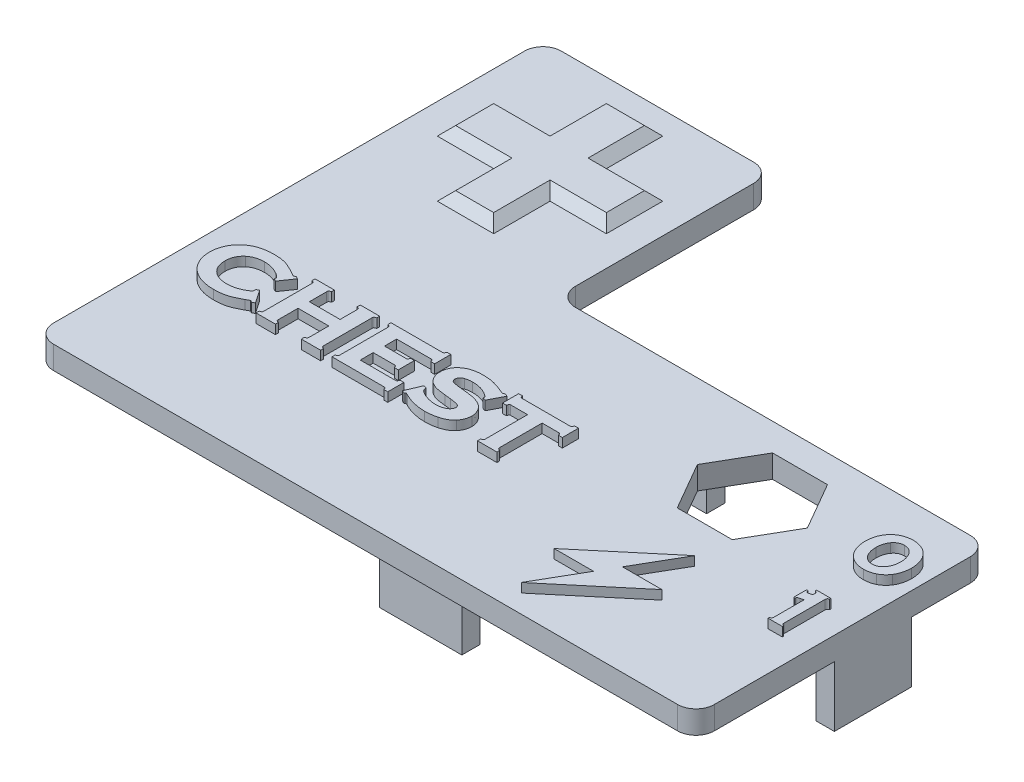
from build123d import *

# Parameters (mm, degrees)
BOSS_EXTRUDE1_DEPTH = 2.5
FILLET1_R           = 2
SKETCH2_W           = 2
SKETCH2_H           = 8.4
SKETCH2_W_2         = 9
SKETCH2_H_2         = 2
BOSS_EXTRUDE2_DEPTH = 6.6
BOSS_EXTRUDE3_DEPTH = 1
CUT_EXTRUDE1_DEPTH  = 2.5
CHAMFER1_SIZE       = 1


with BuildPart() as part:
    # Sketch1 → Boss-Extrude1 (new body)
    with BuildSketch(Plane(origin=(0, 0, 0), x_dir=(1, 0, 0), z_dir=(0, 1, 0))):
        Polygon((-36.05, 15.975), (-36.05, 39.425), (-11.05, 39.425), (-11.05, 15.975), (36.05, 15.975), (36.05, -15.975), (-36.05, -15.975), align=None)
    extrude(amount=BOSS_EXTRUDE1_DEPTH)

    # Fillet1
    fillet1_edges = [part.edges().sort_by_distance(p)[0] for p in [
        (36.05, 1.25, 15.975),
        (-36.05, 1.25, 15.975),
        (-36.05, 1.25, -39.425),
        (-11.05, 1.25, -39.425),
        (-11.05, 1.25, -15.975),
        (36.05, 1.25, -15.975),
    ]]
    fillet(fillet1_edges, radius=FILLET1_R)

    # Sketch2 → Boss-Extrude2 (add)
    with BuildSketch(Plane.XZ):
        with Locations((35.05, -3.325)):
            Rectangle(SKETCH2_W, SKETCH2_H)
        with Locations((4, -13.725)):
            Rectangle(SKETCH2_W_2, SKETCH2_H_2)
        with Locations((4, 12.975)):
            Rectangle(SKETCH2_W_2, SKETCH2_H_2)
    extrude(amount=BOSS_EXTRUDE2_DEPTH)

    # Sketch3 → Boss-Extrude3 (add)
    # profile 1 of 9: a face of its own
    with BuildSketch(Plane(origin=(0, 2.5, 0), x_dir=(1, 0, 0), z_dir=(0, 1, 0))):
        Polygon((21.914101615, -1.975), (19.027350269, -6.975), (23.328173533, -6.975), (14.985898385, -13.975), (17.872649731, -8.975), (13.571826467, -8.975), align=None)
    # profile 2 of 9: a face of its own
    with BuildSketch(Plane(origin=(0, 2.5, 0), x_dir=(1, 0, 0), z_dir=(0, 1, 0))):
        Polygon((-26.625, 36.925), (-20.475, 36.925), (-20.475, 30.775), (-14.325, 30.775), (-14.325, 24.625), (-20.475, 24.625), (-20.475, 18.475), (-26.625, 18.475), (-26.625, 24.625), (-32.775, 24.625), (-32.775, 30.775), (-26.625, 30.775), align=None)
    # profile 3 of 9: a face of its own
    with BuildSketch(Plane(origin=(0, 2.5, 0), x_dir=(1, 0, 0), z_dir=(0, 1, 0))):
        with BuildLine():
            Line((-26.894813368, -0.636469184), (-25.927430556, -2.062738715))
            Line((-25.927430556, -2.062738715), (-26.209928385, -2.217078993))
            add(Edge.make_bspline(
                [(-26.209928385, -2.217078993), (-26.236361041, -2.199689587), (-26.283095295, -2.168944249), (-26.347200787, -2.133330606), (-26.393898593, -2.108466046), (-26.421566856, -2.103251124), (-26.431792535, -2.101323785)],
                knots=[0, 0, 0, 0, 1.506381343, 2.663357431, 3.506001572, 4, 4, 4, 4], degree=3))
            add(Edge.make_bspline(
                [(-26.431792535, -2.101323785), (-26.435035074, -2.102167482), (-26.445650246, -2.104929513), (-26.465638441, -2.115542304), (-26.495961237, -2.132303643), (-26.537348116, -2.154346003), (-26.590415518, -2.181506069), (-26.65291147, -2.218056546), (-26.727248956, -2.258703637), (-26.780003792, -2.288228626), (-26.807996962, -2.303895399)],
                knots=[0, 0, 0, 0, 0.187702156, 0.614484659, 1.260601629, 2.137219343, 3.244382904, 4.606733959, 6.199439564, 8, 8, 8, 8], degree=3))
            add(Edge.make_bspline(
                [(-26.807996962, -2.303895399), (-26.87122569, -2.339102594), (-26.995129961, -2.408095311), (-27.179003486, -2.50396911), (-27.356230558, -2.591553945), (-27.527485378, -2.669878925), (-27.691605228, -2.741494197), (-27.849382389, -2.804526485), (-28.001258021, -2.855937438), (-28.196914161, -2.919009491), (-28.451683646, -2.977168748), (-28.774830314, -3.028085518), (-29.124819778, -3.058445208), (-29.366953184, -3.061573507), (-29.492415365, -3.063194444)],
                knots=[0, 0, 0, 0, 0.921054053, 1.804915809, 2.638978021, 3.436848451, 4.201446302, 4.917975105, 5.59836476, 6.24183433, 7.533677527, 8.918717815, 10.403424004, 12, 12, 12, 12], degree=3))
            add(Edge.make_bspline(
                [(-29.492415365, -3.063194444), (-29.615133451, -3.061133719), (-29.855519351, -3.057097074), (-30.207438089, -3.023871777), (-30.542298711, -2.967595861), (-30.8603479, -2.888430115), (-31.163079962, -2.790476428), (-31.448156874, -2.667282235), (-31.715978069, -2.520930779), (-31.881943534, -2.406414591), (-31.964615885, -2.34937066)],
                knots=[0, 0, 0, 0, 1.125109477, 2.20391682, 3.23774691, 4.235813866, 5.206815296, 6.152004144, 7.079458112, 8, 8, 8, 8], degree=3))
            add(Edge.make_bspline(
                [(-31.964615885, -2.34937066), (-32.057476969, -2.277589153), (-32.241429136, -2.135394349), (-32.482556536, -1.884831122), (-32.69715506, -1.613442084), (-32.81131996, -1.413445857), (-32.868608941, -1.313085937)],
                knots=[0, 0, 0, 0, 1.01448403, 2.00963125, 3.001214929, 4, 4, 4, 4], degree=3))
            add(Edge.make_bspline(
                [(-32.868608941, -1.313085937), (-32.898805478, -1.254206028), (-32.959262557, -1.136321409), (-33.035724731, -0.952288432), (-33.102709332, -0.764106586), (-33.154314765, -0.570247852), (-33.195854736, -0.372918807), (-33.226399864, -0.171006974), (-33.244766375, 0.036126499), (-33.246627979, 0.176076609), (-33.247569444, 0.246853299)],
                knots=[0, 0, 0, 0, 0.978850926, 1.959776591, 2.946525775, 3.932595758, 4.92578581, 5.929411661, 6.952845503, 8, 8, 8, 8], degree=3))
            add(Edge.make_bspline(
                [(-33.247569444, 0.246853299), (-33.245411831, 0.342030872), (-33.241147045, 0.530160944), (-33.208508022, 0.807055045), (-33.157096579, 1.075332119), (-33.080269488, 1.332476579), (-32.985256818, 1.581464209), (-32.867642042, 1.819613037), (-32.729634632, 2.04941236), (-32.621449529, 2.192197867), (-32.566818576, 2.264301215)],
                knots=[0, 0, 0, 0, 1.051920143, 2.079248334, 3.078108134, 4.067904472, 5.042050454, 6.020844056, 7.000572431, 8, 8, 8, 8], degree=3))
            add(Edge.make_bspline(
                [(-32.566818576, 2.264301215), (-32.523283593, 2.316689742), (-32.436759627, 2.420809755), (-32.297456801, 2.567911172), (-32.147445951, 2.702141162), (-31.992371448, 2.829915271), (-31.827805963, 2.945735447), (-31.654906088, 3.050704948), (-31.473596359, 3.145401826), (-31.285850321, 3.233114857), (-31.088392524, 3.306496101), (-30.884371041, 3.373958617), (-30.670871995, 3.427799372), (-30.44990146, 3.474076583), (-30.220660397, 3.507863644), (-29.98388256, 3.532495587), (-29.738831492, 3.548083786), (-29.572824216, 3.550273651), (-29.48828125, 3.551388889)],
                knots=[0, 0, 0, 0, 0.945096066, 1.878339031, 2.807896075, 3.736687935, 4.665129786, 5.597588805, 6.541329771, 7.502474639, 8.470820773, 9.462547861, 10.482887262, 11.524194462, 12.594212061, 13.69652881, 14.826905116, 16, 16, 16, 16], degree=3))
            add(Edge.make_bspline(
                [(-29.48828125, 3.551388889), (-29.363292425, 3.549107108), (-29.122114928, 3.544704199), (-28.773183497, 3.515760132), (-28.451987621, 3.46130991), (-28.19911822, 3.400725267), (-28.004813844, 3.335696444), (-27.853110278, 3.282026491), (-27.696514353, 3.213571526), (-27.530489978, 3.142517762), (-27.359965335, 3.056501073), (-27.180588871, 2.965005099), (-26.994566689, 2.862824613), (-26.86937949, 2.789628266), (-26.805240885, 2.752126736)],
                knots=[0, 0, 0, 0, 1.583391883, 3.05530107, 4.429937215, 5.707129045, 6.343800094, 7.024870534, 7.744613557, 8.507938695, 9.312046582, 10.163041542, 11.058849845, 12, 12, 12, 12], degree=3))
            add(Edge.make_bspline(
                [(-26.805240885, 2.752126736), (-26.777135195, 2.736199258), (-26.724491578, 2.706366152), (-26.652183798, 2.662475207), (-26.588497038, 2.629254216), (-26.536921736, 2.599766884), (-26.496135912, 2.575672822), (-26.464737121, 2.560520438), (-26.44529341, 2.548829556), (-26.435045732, 2.546242338), (-26.431792535, 2.545421007)],
                knots=[0, 0, 0, 0, 1.815007712, 3.399616623, 4.750773999, 5.848744586, 6.73864692, 7.408159822, 7.812116192, 8, 8, 8, 8], degree=3))
            add(Edge.make_bspline(
                [(-26.431792535, 2.545421007), (-26.42107337, 2.547256294), (-26.392633988, 2.552125558), (-26.345941342, 2.579221383), (-26.281493688, 2.616172536), (-26.234099928, 2.647507057), (-26.207172309, 2.66531033)],
                knots=[0, 0, 0, 0, 0.506273769, 1.343212145, 2.490498108, 4, 4, 4, 4], degree=3))
            Line((-26.207172309, 2.66531033), (-25.927430556, 2.504079861))
            Line((-25.927430556, 2.504079861), (-26.894813368, 1.103993056))
            Line((-26.894813368, 1.103993056), (-27.178689236, 1.233528646))
            add(Edge.make_bspline(
                [(-27.178689236, 1.233528646), (-27.175911931, 1.26795848), (-27.171397644, 1.323921428), (-27.170692376, 1.380051779), (-27.170421007, 1.401649306)],
                knots=[0, 0, 0, 0, 1.230451045, 2, 2, 2, 2], degree=3))
            add(Edge.make_bspline(
                [(-27.170421007, 1.401649306), (-27.171316158, 1.418387402), (-27.173165893, 1.452974895), (-27.194931786, 1.50301962), (-27.225446179, 1.553526706), (-27.270712144, 1.604559864), (-27.332615916, 1.659906429), (-27.416233287, 1.721160333), (-27.522243566, 1.791420225), (-27.602385498, 1.838021537), (-27.645844184, 1.863292101)],
                knots=[0, 0, 0, 0, 0.580273203, 1.199072782, 1.874962125, 2.636043996, 3.566038856, 4.767547394, 6.247133053, 8, 8, 8, 8], degree=3))
            add(Edge.make_bspline(
                [(-27.645844184, 1.863292101), (-27.711109111, 1.899463475), (-27.840561205, 1.971208903), (-28.041020986, 2.064085797), (-28.245263437, 2.140140497), (-28.45119448, 2.206395907), (-28.66087759, 2.255951479), (-28.873798779, 2.289396343), (-29.089033309, 2.313223039), (-29.233738128, 2.315515731), (-29.306380208, 2.316666667)],
                knots=[0, 0, 0, 0, 1.028142303, 2.039306239, 3.041033421, 4.030078727, 5.018921423, 6.006567867, 6.999293467, 8, 8, 8, 8], degree=3))
            add(Edge.make_bspline(
                [(-29.306380208, 2.316666667), (-29.385905192, 2.315038761), (-29.541176422, 2.311860301), (-29.768366115, 2.288229956), (-29.984203164, 2.248703574), (-30.188682329, 2.191729878), (-30.382542326, 2.120791566), (-30.564099829, 2.031608875), (-30.734616525, 1.92759366), (-30.838177751, 1.84510948), (-30.889746094, 1.804036458)],
                knots=[0, 0, 0, 0, 1.122809716, 2.192267609, 3.221470532, 4.217602693, 5.186305145, 6.131997782, 7.069827752, 8, 8, 8, 8], degree=3))
            add(Edge.make_bspline(
                [(-30.889746094, 1.804036458), (-30.944258928, 1.755664238), (-31.052194066, 1.659887485), (-31.191202935, 1.495833836), (-31.310017959, 1.319693308), (-31.404961245, 1.129348929), (-31.479968909, 0.926536972), (-31.533508847, 0.710777157), (-31.565597749, 0.481623582), (-31.569747825, 0.324587891), (-31.571875, 0.244097222)],
                knots=[0, 0, 0, 0, 0.991916837, 1.963990341, 2.920404688, 3.880416128, 4.854642933, 5.861005588, 6.903630834, 8, 8, 8, 8], degree=3))
            add(Edge.make_bspline(
                [(-31.571875, 0.244097222), (-31.569743111, 0.163608295), (-31.565583838, 0.006576002), (-31.533560568, -0.22260182), (-31.479680222, -0.438693381), (-31.405303919, -0.642203146), (-31.309966248, -0.83284883), (-31.191262366, -1.009073472), (-31.051799803, -1.173109701), (-30.94420348, -1.269707402), (-30.889746094, -1.31859809)],
                knots=[0, 0, 0, 0, 1.094980273, 2.136284708, 3.141372491, 4.120229904, 5.07902519, 6.03422794, 7.00507001, 8, 8, 8, 8], degree=3))
            add(Edge.make_bspline(
                [(-30.889746094, -1.31859809), (-30.83823079, -1.359748954), (-30.734964003, -1.442239344), (-30.564048106, -1.544883236), (-30.382546995, -1.632015097), (-30.189752114, -1.703923292), (-29.985550298, -1.760423855), (-29.769306286, -1.800176346), (-29.541625082, -1.823588692), (-29.385902382, -1.826821394), (-29.306380208, -1.828472222)],
                knots=[0, 0, 0, 0, 0.930852733, 1.865973124, 2.809526276, 3.772855155, 4.769716054, 5.799671909, 6.876368871, 8, 8, 8, 8], degree=3))
            add(Edge.make_bspline(
                [(-29.306380208, -1.828472222), (-29.233753815, -1.827151687), (-29.088668334, -1.824513658), (-28.87279357, -1.80311089), (-28.659447384, -1.769213438), (-28.450323453, -1.718862092), (-28.243630831, -1.656596479), (-28.039691038, -1.5813472), (-27.839545103, -1.489781113), (-27.709783751, -1.419913158), (-27.644466146, -1.384743924)],
                knots=[0, 0, 0, 0, 1.001816356, 2.001324861, 2.990066645, 3.980006005, 4.966409349, 5.967022273, 6.97666575, 8, 8, 8, 8], degree=3))
            add(Edge.make_bspline(
                [(-27.644466146, -1.384743924), (-27.601023221, -1.359918619), (-27.520957927, -1.314165591), (-27.414906015, -1.245324487), (-27.3314701, -1.185321704), (-27.26891952, -1.131495266), (-27.224212527, -1.080408787), (-27.193517506, -1.030629671), (-27.173321859, -0.980641329), (-27.171378139, -0.946703212), (-27.170421007, -0.929991319)],
                knots=[0, 0, 0, 0, 1.757425455, 3.238934429, 4.439578554, 5.365580981, 6.132204324, 6.813014849, 7.415501801, 8, 8, 8, 8], degree=3))
            add(Edge.make_bspline(
                [(-27.170421007, -0.929991319), (-27.17068799, -0.909311841), (-27.171377153, -0.855932009), (-27.175911504, -0.802730191), (-27.178689236, -0.770138889)],
                knots=[0, 0, 0, 0, 0.774804922, 2, 2, 2, 2], degree=3))
            Line((-27.178689236, -0.770138889), (-26.894813368, -0.636469184))
        make_face()
    # profile 4 of 9: a face of its own
    with BuildSketch(Plane(origin=(0, 2.5, 0), x_dir=(1, 0, 0), z_dir=(0, 1, 0))):
        with BuildLine():
            Line((-19.753819444, -0.240972222), (-23.105208333, -0.240972222))
            Line((-23.105208333, -0.240972222), (-23.105208333, -2.383821615))
            add(Edge.make_bspline(
                [(-23.105208333, -2.383821615), (-23.104699813, -2.404062044), (-23.103771671, -2.441004541), (-23.096863022, -2.491370285), (-23.08705265, -2.531950328), (-23.069274696, -2.565289708), (-23.036066596, -2.591094351), (-22.987569905, -2.614286603), (-22.920184581, -2.63858303), (-22.869172598, -2.654599914), (-22.840625, -2.663563368)],
                knots=[0, 0, 0, 0, 1.112689861, 2.030863194, 2.79083513, 3.401849183, 4.06495506, 5.059212787, 6.354261028, 8, 8, 8, 8], degree=3))
            Line((-22.840625, -2.663563368), (-22.840625, -2.975))
            Line((-22.840625, -2.975), (-24.957291667, -2.975))
            Line((-24.957291667, -2.975), (-24.957291667, -2.645648872))
            add(Edge.make_bspline(
                [(-24.957291667, -2.645648872), (-24.929235748, -2.636151769), (-24.878729532, -2.619055102), (-24.811750054, -2.594288211), (-24.763940792, -2.568428587), (-24.720966902, -2.534493362), (-24.696227789, -2.468688109), (-24.693987836, -2.41467495), (-24.692708333, -2.383821615)],
                knots=[0, 0, 0, 0, 1.287370472, 2.317522002, 3.094744379, 3.646673391, 4.655735433, 6, 6, 6, 6], degree=3))
            Line((-24.692708333, -2.383821615), (-24.692708333, 2.872016059))
            add(Edge.make_bspline(
                [(-24.692708333, 2.872016059), (-24.693871972, 2.90291911), (-24.695893403, 2.956602786), (-24.721358131, 3.02155467), (-24.763923688, 3.055250295), (-24.811757099, 3.081102433), (-24.878726996, 3.105872295), (-24.929234842, 3.122968456), (-24.957291667, 3.132465278)],
                knots=[0, 0, 0, 0, 1.348336138, 2.342281394, 2.895882114, 3.675458579, 4.708730281, 6, 6, 6, 6], degree=3))
            Line((-24.957291667, 3.132465278), (-24.957291667, 3.463194444))
            Line((-24.957291667, 3.463194444), (-22.840625, 3.463194444))
            Line((-22.840625, 3.463194444), (-22.840625, 3.149001736))
            add(Edge.make_bspline(
                [(-22.840625, 3.149001736), (-22.869715234, 3.140736863), (-22.921468391, 3.12603319), (-22.988507273, 3.100588695), (-23.037628163, 3.079363184), (-23.070389512, 3.053980126), (-23.086780103, 3.021221078), (-23.097163429, 2.98196032), (-23.103627931, 2.932384698), (-23.104652701, 2.895920899), (-23.105208333, 2.876150174)],
                knots=[0, 0, 0, 0, 1.678835892, 2.986743234, 3.979464292, 4.649154438, 5.231503203, 5.974457713, 6.90174799, 8, 8, 8, 8], degree=3))
            Line((-23.105208333, 2.876150174), (-23.105208333, 0.99375))
            Line((-23.105208333, 0.99375), (-19.753819444, 0.99375))
            Line((-19.753819444, 0.99375), (-19.753819444, 2.876150174))
            add(Edge.make_bspline(
                [(-19.753819444, 2.876150174), (-19.754774347, 2.906725209), (-19.756469194, 2.960992525), (-19.784941489, 3.024988409), (-19.827691495, 3.059427337), (-19.875101744, 3.085011392), (-19.940852101, 3.108918029), (-19.990740087, 3.123179378), (-20.018402778, 3.13108724)],
                knots=[0, 0, 0, 0, 1.339108124, 2.3767692, 2.934819577, 3.720662016, 4.736116083, 6, 6, 6, 6], degree=3))
            Line((-20.018402778, 3.13108724), (-20.018402778, 3.463194444))
            Line((-20.018402778, 3.463194444), (-17.901736111, 3.463194444))
            Line((-17.901736111, 3.463194444), (-17.901736111, 3.151757813))
            add(Edge.make_bspline(
                [(-17.901736111, 3.151757813), (-17.930756349, 3.142373337), (-17.982743019, 3.125562048), (-18.050885467, 3.099834777), (-18.099818842, 3.076489432), (-18.132921051, 3.051272443), (-18.149192131, 3.018441172), (-18.160019487, 2.979312497), (-18.164212942, 2.929039758), (-18.165573084, 2.892220265), (-18.166319444, 2.872016059)],
                knots=[0, 0, 0, 0, 1.677063113, 3.004280154, 3.998210204, 4.661097541, 5.237530725, 5.972938197, 6.887676847, 8, 8, 8, 8], degree=3))
            Line((-18.166319444, 2.872016059), (-18.166319444, -2.383821615))
            add(Edge.make_bspline(
                [(-18.166319444, -2.383821615), (-18.165605272, -2.404487304), (-18.164316812, -2.441770881), (-18.15981505, -2.492921509), (-18.149384436, -2.532520488), (-18.133272035, -2.565849021), (-18.099476921, -2.589006053), (-18.052193072, -2.613649766), (-17.983620937, -2.638792842), (-17.931188556, -2.655536255), (-17.901736111, -2.664941406)],
                knots=[0, 0, 0, 0, 1.132588045, 2.043335292, 2.79974177, 3.373659724, 4.017655279, 4.984956659, 6.306382474, 8, 8, 8, 8], degree=3))
            Line((-17.901736111, -2.664941406), (-17.901736111, -2.975))
            Line((-17.901736111, -2.975), (-20.018402778, -2.975))
            Line((-20.018402778, -2.975), (-20.018402778, -2.644270833))
            add(Edge.make_bspline(
                [(-20.018402778, -2.644270833), (-19.990652242, -2.636054777), (-19.940548721, -2.62122071), (-19.875966499, -2.594668492), (-19.826802485, -2.571594882), (-19.785260489, -2.534759181), (-19.756381284, -2.470161631), (-19.754742046, -2.414915461), (-19.753819444, -2.383821615)],
                knots=[0, 0, 0, 0, 1.258257265, 2.271780215, 3.040906906, 3.607086496, 4.653211897, 6, 6, 6, 6], degree=3))
            Line((-19.753819444, -2.383821615), (-19.753819444, -0.240972222))
        make_face()
    # profile 5 of 9: a face of its own
    with BuildSketch(Plane(origin=(0, 2.5, 0), x_dir=(1, 0, 0), z_dir=(0, 1, 0))):
        with BuildLine():
            Line((-14.814930556, -0.329166667), (-14.814930556, -1.740277778))
            Line((-14.814930556, -1.740277778), (-10.997764757, -1.740277778))
            add(Edge.make_bspline(
                [(-10.997764757, -1.740277778), (-10.96681399, -1.739196439), (-10.912435727, -1.737296604), (-10.847344175, -1.710572029), (-10.813073957, -1.667750897), (-10.787572958, -1.619542044), (-10.760706746, -1.553870821), (-10.744714098, -1.50339503), (-10.7359375, -1.475694444)],
                knots=[0, 0, 0, 0, 1.34636125, 2.365459444, 2.918249314, 3.696683944, 4.73596426, 6, 6, 6, 6], degree=3))
            Line((-10.7359375, -1.475694444), (-10.317013889, -1.475694444))
            Line((-10.317013889, -1.475694444), (-10.317013889, -3.239583333))
            Line((-10.317013889, -3.239583333), (-10.7359375, -3.239583333))
            add(Edge.make_bspline(
                [(-10.7359375, -3.239583333), (-10.745417741, -3.211528728), (-10.762347615, -3.161428635), (-10.787206374, -3.094617869), (-10.814588681, -3.047847345), (-10.848355915, -3.005029981), (-10.911432841, -2.978204932), (-10.964041962, -2.976153677), (-10.993630642, -2.975)],
                knots=[0, 0, 0, 0, 1.304247938, 2.329134225, 3.126603422, 3.68576824, 4.698418437, 6, 6, 6, 6], degree=3))
            Line((-10.993630642, -2.975), (-16.667013889, -2.975))
            Line((-16.667013889, -2.975), (-16.667013889, -2.645648872))
            add(Edge.make_bspline(
                [(-16.667013889, -2.645648872), (-16.638958843, -2.636151539), (-16.588454199, -2.619054457), (-16.521465486, -2.594290002), (-16.473679502, -2.568424236), (-16.430297605, -2.534244531), (-16.405801517, -2.466247275), (-16.403664548, -2.41050045), (-16.402430556, -2.378309462)],
                knots=[0, 0, 0, 0, 1.270903566, 2.287878308, 3.055159144, 3.600028367, 4.614137041, 6, 6, 6, 6], degree=3))
            Line((-16.402430556, -2.378309462), (-16.402430556, 2.866503906))
            add(Edge.make_bspline(
                [(-16.402430556, 2.866503906), (-16.403546203, 2.898744591), (-16.405463775, 2.954159803), (-16.430686729, 3.021309284), (-16.473663711, 3.055245134), (-16.52147199, 3.081104559), (-16.588451858, 3.105871529), (-16.638958007, 3.122968183), (-16.667013889, 3.132465278)],
                knots=[0, 0, 0, 0, 1.390022291, 2.38916702, 2.935671537, 3.705255179, 4.725282125, 6, 6, 6, 6], degree=3))
            Line((-16.667013889, 3.132465278), (-16.667013889, 3.463194444))
            Line((-16.667013889, 3.463194444), (-11.083203125, 3.463194444))
            add(Edge.make_bspline(
                [(-11.083203125, 3.463194444), (-11.053150653, 3.46428904), (-11.000072459, 3.466222296), (-10.936541645, 3.49321999), (-10.902802892, 3.53604972), (-10.875057591, 3.583131768), (-10.851140482, 3.650308925), (-10.83373638, 3.700229281), (-10.824131944, 3.727777778)],
                knots=[0, 0, 0, 0, 1.317339458, 2.326663858, 2.883992238, 3.678842347, 4.719071565, 6, 6, 6, 6], degree=3))
            Line((-10.824131944, 3.727777778), (-10.405208333, 3.727777778))
            Line((-10.405208333, 3.727777778), (-10.405208333, 1.963888889))
            Line((-10.405208333, 1.963888889), (-10.824131944, 1.963888889))
            add(Edge.make_bspline(
                [(-10.824131944, 1.963888889), (-10.832807687, 1.99164166), (-10.848490131, 2.041808123), (-10.876233321, 2.106542284), (-10.901022192, 2.155193321), (-10.937673782, 2.197088972), (-11.001980788, 2.225704461), (-11.056725918, 2.227479622), (-11.08733724, 2.228472222)],
                knots=[0, 0, 0, 0, 1.263696698, 2.284283375, 3.062509213, 3.628357544, 4.673870881, 6, 6, 6, 6], degree=3))
            Line((-11.08733724, 2.228472222), (-14.814930556, 2.228472222))
            Line((-14.814930556, 2.228472222), (-14.814930556, 0.905555556))
            Line((-14.814930556, 0.905555556), (-12.494314236, 0.905555556))
            add(Edge.make_bspline(
                [(-12.494314236, 0.905555556), (-12.463401105, 0.906713921), (-12.409699916, 0.908726192), (-12.344839217, 0.934238618), (-12.310679077, 0.977014664), (-12.286041557, 1.025458111), (-12.259780326, 1.091604251), (-12.244038704, 1.141987303), (-12.235243056, 1.170138889)],
                knots=[0, 0, 0, 0, 1.350007337, 2.345184541, 2.899471423, 3.697568048, 4.713513627, 6, 6, 6, 6], degree=3))
            Line((-12.235243056, 1.170138889), (-11.816319444, 1.170138889))
            Line((-11.816319444, 1.170138889), (-11.816319444, -0.59375))
            Line((-11.816319444, -0.59375), (-12.235243056, -0.59375))
            add(Edge.make_bspline(
                [(-12.235243056, -0.59375), (-12.244812139, -0.566642156), (-12.262127324, -0.517590719), (-12.286491853, -0.451549956), (-12.31386803, -0.404719593), (-12.347894063, -0.361965651), (-12.41079639, -0.333328245), (-12.464181571, -0.330668136), (-12.494314236, -0.329166667)],
                knots=[0, 0, 0, 0, 1.26750182, 2.293534889, 3.091896403, 3.651686891, 4.674521096, 6, 6, 6, 6], degree=3))
            Line((-12.494314236, -0.329166667), (-14.814930556, -0.329166667))
        make_face()
    # profile 6 of 9: a face of its own
    with BuildSketch(Plane(origin=(0, 2.5, 0), x_dir=(1, 0, 0), z_dir=(0, 1, 0))):
        with BuildLine():
            Line((-3.396506076, 2.847211372), (-4.220572917, 1.270735677))
            Line((-4.220572917, 1.270735677), (-4.532009549, 1.382356771))
            add(Edge.make_bspline(
                [(-4.532009549, 1.382356771), (-4.531071564, 1.408998199), (-4.52963228, 1.449877955), (-4.52832927, 1.490762258), (-4.527875434, 1.50500217)],
                knots=[0, 0, 0, 0, 1.303404452, 2, 2, 2, 2], degree=3))
            add(Edge.make_bspline(
                [(-4.527875434, 1.50500217), (-4.531125911, 1.524381846), (-4.538585205, 1.568854918), (-4.588418516, 1.631134968), (-4.660714707, 1.698118882), (-4.721478584, 1.740511258), (-4.755251736, 1.764073351)],
                knots=[0, 0, 0, 0, 0.655057032, 1.503244898, 2.612279321, 4, 4, 4, 4], degree=3))
            add(Edge.make_bspline(
                [(-4.755251736, 1.764073351), (-4.822044163, 1.808460817), (-4.955105924, 1.896888124), (-5.167567756, 2.007837062), (-5.387171536, 2.103368779), (-5.615472255, 2.182513179), (-5.852915023, 2.243048336), (-6.099039197, 2.285042717), (-6.353153785, 2.312478648), (-6.525499095, 2.315258023), (-6.612847222, 2.316666667)],
                knots=[0, 0, 0, 0, 0.976967083, 1.946282931, 2.916762424, 3.894194695, 4.888260298, 5.899910281, 6.935631579, 8, 8, 8, 8], degree=3))
            add(Edge.make_bspline(
                [(-6.612847222, 2.316666667), (-6.682281156, 2.315566917), (-6.817844475, 2.313419758), (-7.015820734, 2.290151054), (-7.204201107, 2.25570167), (-7.324179757, 2.219894889), (-7.383170573, 2.202289497)],
                knots=[0, 0, 0, 0, 1.065149838, 2.079606309, 3.055785418, 4, 4, 4, 4], degree=3))
            add(Edge.make_bspline(
                [(-7.383170573, 2.202289497), (-7.413827826, 2.190178609), (-7.475142331, 2.165956834), (-7.561357261, 2.115894538), (-7.639578869, 2.053081321), (-7.71152947, 1.982030389), (-7.772379165, 1.902149433), (-7.815740223, 1.813192561), (-7.843482144, 1.717962957), (-7.846190433, 1.651727297), (-7.847569444, 1.618001302)],
                knots=[0, 0, 0, 0, 0.993652996, 1.987305992, 2.99382794, 4.013056368, 5.033132543, 6.006275506, 6.984831695, 8, 8, 8, 8], degree=3))
            add(Edge.make_bspline(
                [(-7.847569444, 1.618001302), (-7.846946797, 1.593588457), (-7.845749055, 1.546627243), (-7.831826301, 1.47949037), (-7.808147375, 1.41955602), (-7.776141457, 1.366310383), (-7.734906495, 1.319308723), (-7.683960058, 1.279653977), (-7.623332768, 1.247889009), (-7.579526063, 1.232081687), (-7.556803385, 1.223882378)],
                knots=[0, 0, 0, 0, 1.102963316, 2.12169029, 3.082404965, 4.00530384, 4.918090382, 5.894847784, 6.908050859, 8, 8, 8, 8], degree=3))
            add(Edge.make_bspline(
                [(-7.556803385, 1.223882378), (-7.536181892, 1.218172449), (-7.490634464, 1.205560724), (-7.414639955, 1.189599656), (-7.324600578, 1.172953382), (-7.220679208, 1.156942698), (-7.102215609, 1.139945001), (-6.969727656, 1.124464011), (-6.822979939, 1.105336417), (-6.720369536, 1.095413397), (-6.666590712, 1.090212674)],
                knots=[0, 0, 0, 0, 0.569784533, 1.25850343, 2.067174491, 3.00850413, 4.058735915, 5.254514493, 6.561071985, 8, 8, 8, 8], degree=3))
            Line((-6.666590712, 1.090212674), (-5.962413194, 1.017176649))
            add(Edge.make_bspline(
                [(-5.962413194, 1.017176649), (-5.856181715, 1.004735653), (-5.653781292, 0.981032106), (-5.367106588, 0.933571788), (-5.111268955, 0.88297866), (-4.884936201, 0.821623451), (-4.681878996, 0.752060344), (-4.496842804, 0.6732499), (-4.325767179, 0.586592094), (-4.222678428, 0.516649739), (-4.17234158, 0.48249783)],
                knots=[0, 0, 0, 0, 1.359231557, 2.589713005, 3.6923467, 4.672414876, 5.567883986, 6.418052333, 7.227556273, 8, 8, 8, 8], degree=3))
            add(Edge.make_bspline(
                [(-4.17234158, 0.48249783), (-4.11372012, 0.437035481), (-3.998564968, 0.347729899), (-3.848468993, 0.191433762), (-3.722633089, 0.020835959), (-3.619107869, -0.161703039), (-3.537918877, -0.352770735), (-3.479985069, -0.549265712), (-3.44371651, -0.74996084), (-3.439812767, -0.885282954), (-3.437847222, -0.953417969)],
                knots=[0, 0, 0, 0, 1.062112761, 2.086399006, 3.093661336, 4.093127116, 5.087223183, 6.062081265, 7.024253179, 8, 8, 8, 8], degree=3))
            add(Edge.make_bspline(
                [(-3.437847222, -0.953417969), (-3.439032518, -1.008160881), (-3.441392998, -1.11717971), (-3.464659542, -1.278506544), (-3.50004607, -1.436924761), (-3.551858034, -1.591566624), (-3.616479991, -1.743382956), (-3.695823682, -1.891791846), (-3.789553809, -2.037269966), (-3.862395816, -2.129016611), (-3.899490017, -2.175737847)],
                knots=[0, 0, 0, 0, 0.984507936, 1.960617353, 2.927124942, 3.902113762, 4.890880584, 5.892997435, 6.927026006, 8, 8, 8, 8], degree=3))
            add(Edge.make_bspline(
                [(-3.899490017, -2.175737847), (-3.933030113, -2.214759917), (-4.001404015, -2.29430922), (-4.123857762, -2.399322334), (-4.258267314, -2.500788125), (-4.410245913, -2.592262154), (-4.575512746, -2.680245442), (-4.758529332, -2.757134696), (-4.955509994, -2.831721474), (-5.094381735, -2.871717765), (-5.165907118, -2.892317708)],
                knots=[0, 0, 0, 0, 0.834835566, 1.701872463, 2.613833744, 3.568666275, 4.580119083, 5.653131184, 6.791253792, 8, 8, 8, 8], degree=3))
            add(Edge.make_bspline(
                [(-5.165907118, -2.892317708), (-5.268460318, -2.91868686), (-5.477037057, -2.972317481), (-5.802029873, -3.024573512), (-6.141355552, -3.056822681), (-6.3725335, -3.061045203), (-6.490201823, -3.063194444)],
                knots=[0, 0, 0, 0, 0.948384972, 1.928862733, 2.945802358, 4, 4, 4, 4], degree=3))
            add(Edge.make_bspline(
                [(-6.490201823, -3.063194444), (-6.594073086, -3.061238036), (-6.801256402, -3.057335751), (-7.111462154, -3.028897179), (-7.420299387, -2.982297726), (-7.727927407, -2.915498841), (-8.034936419, -2.831363228), (-8.340534073, -2.728065519), (-8.644850754, -2.60498281), (-8.843893246, -2.510248042), (-8.944487847, -2.462369792)],
                knots=[0, 0, 0, 0, 0.977743129, 1.950222396, 2.929942918, 3.916330384, 4.911888304, 5.925169257, 6.951395912, 8, 8, 8, 8], degree=3))
            add(Edge.make_bspline(
                [(-8.944487847, -2.462369792), (-8.979313752, -2.446069282), (-9.040045766, -2.417643237), (-9.118767305, -2.383867118), (-9.170860179, -2.360468486), (-9.198442536, -2.354221768), (-9.207693142, -2.352126736)],
                knots=[0, 0, 0, 0, 1.613868705, 2.814384752, 3.602366811, 4, 4, 4, 4], degree=3))
            add(Edge.make_bspline(
                [(-9.207693142, -2.352126736), (-9.207071646, -2.354015237), (-9.203130554, -2.365990771), (-9.243448107, -2.38098481), (-9.282575503, -2.412506079), (-9.324582948, -2.436837304), (-9.349631076, -2.451345486)],
                knots=[0, 0, 0, 0, 0.128302542, 0.813604024, 2.100021208, 4, 4, 4, 4], degree=3))
            Line((-9.349631076, -2.451345486), (-9.611458333, -2.336968316))
            Line((-9.611458333, -2.336968316), (-8.907280816, -0.67781033))
            Line((-8.907280816, -0.67781033), (-8.566905382, -0.803211806))
            add(Edge.make_bspline(
                [(-8.566905382, -0.803211806), (-8.566905382, -0.821585648), (-8.566905382, -0.85052445), (-8.566905382, -0.879463252), (-8.566905382, -0.890028212)],
                knots=[0, 0, 0, 0, 1.26984127, 2, 2, 2, 2], degree=3))
            add(Edge.make_bspline(
                [(-8.566905382, -0.890028212), (-8.565491784, -0.92101203), (-8.562761806, -0.980848792), (-8.536570225, -1.065710803), (-8.495391203, -1.142420922), (-8.455008555, -1.183482961), (-8.434613715, -1.20422092)],
                knots=[0, 0, 0, 0, 1.056364862, 2.040079546, 3.010162421, 4, 4, 4, 4], degree=3))
            add(Edge.make_bspline(
                [(-8.434613715, -1.20422092), (-8.381467135, -1.248395321), (-8.270081622, -1.340976786), (-8.071958823, -1.457040905), (-7.842582928, -1.562099096), (-7.587161126, -1.654927472), (-7.318266331, -1.729791929), (-7.049738262, -1.787358328), (-6.786917009, -1.821703097), (-6.613859823, -1.826241296), (-6.528786892, -1.828472222)],
                knots=[0, 0, 0, 0, 0.811166888, 1.700057442, 2.688020544, 3.774312476, 4.890449695, 5.966279675, 7.000246384, 8, 8, 8, 8], degree=3))
            add(Edge.make_bspline(
                [(-6.528786892, -1.828472222), (-6.438125066, -1.82636084), (-6.262876153, -1.822279546), (-6.011011301, -1.783403444), (-5.777896419, -1.726337654), (-5.636892159, -1.662479461), (-5.568294271, -1.63141276)],
                knots=[0, 0, 0, 0, 1.09938514, 2.125106669, 3.087873494, 4, 4, 4, 4], degree=3))
            add(Edge.make_bspline(
                [(-5.568294271, -1.63141276), (-5.534790461, -1.613292279), (-5.469416095, -1.57793466), (-5.379859877, -1.513495114), (-5.300994711, -1.440865937), (-5.23496187, -1.359141572), (-5.181707591, -1.273472194), (-5.141918791, -1.186215136), (-5.119053808, -1.097424705), (-5.115372219, -1.038057786), (-5.113541667, -1.008539497)],
                knots=[0, 0, 0, 0, 1.127511017, 2.200057805, 3.259226553, 4.294254806, 5.302547675, 6.240723916, 7.125256589, 8, 8, 8, 8], degree=3))
            add(Edge.make_bspline(
                [(-5.113541667, -1.008539497), (-5.11633523, -0.968832587), (-5.121748434, -0.891890852), (-5.176168109, -0.786969664), (-5.262474176, -0.700550044), (-5.338051964, -0.66497705), (-5.378125, -0.646115451)],
                knots=[0, 0, 0, 0, 0.989643958, 1.917674357, 2.89590429, 4, 4, 4, 4], degree=3))
            add(Edge.make_bspline(
                [(-5.378125, -0.646115451), (-5.398254181, -0.638528699), (-5.442597691, -0.62181549), (-5.51715867, -0.60010506), (-5.605680884, -0.580050299), (-5.70812065, -0.559223294), (-5.824902926, -0.539011798), (-5.955718879, -0.517985245), (-6.100579072, -0.499249689), (-6.201723208, -0.487098313), (-6.254557292, -0.480750868)],
                knots=[0, 0, 0, 0, 0.577433191, 1.27205443, 2.082779499, 3.014009565, 4.078543733, 5.264728481, 6.571191888, 8, 8, 8, 8], degree=3))
            Line((-6.254557292, -0.480750868), (-6.924283854, -0.407714844))
            add(Edge.make_bspline(
                [(-6.924283854, -0.407714844), (-6.979438476, -0.40202317), (-7.085716196, -0.391055855), (-7.238448062, -0.370744901), (-7.379186857, -0.353704117), (-7.507157169, -0.3349167), (-7.622837707, -0.319860836), (-7.725374205, -0.30063308), (-7.815698568, -0.285130712), (-7.968863282, -0.252250524), (-8.191066767, -0.184186468), (-8.375538468, -0.094293608), (-8.470442708, -0.048046875)],
                knots=[0, 0, 0, 0, 1.040628763, 2.005192832, 2.891695548, 3.701287162, 4.432842532, 5.080600743, 5.658946044, 6.152708285, 8.020702925, 10, 10, 10, 10], degree=3))
            add(Edge.make_bspline(
                [(-8.470442708, -0.048046875), (-8.538035321, -0.009736726), (-8.672705947, 0.066591906), (-8.849291515, 0.21918362), (-9.007326639, 0.39471757), (-9.089007294, 0.530577662), (-9.130523003, 0.599631076)],
                knots=[0, 0, 0, 0, 0.991843038, 1.976134926, 2.971332993, 4, 4, 4, 4], degree=3))
            add(Edge.make_bspline(
                [(-9.130523003, 0.599631076), (-9.16422127, 0.665854384), (-9.232041585, 0.799133806), (-9.298060793, 1.017041763), (-9.339246881, 1.248024992), (-9.344289671, 1.406975333), (-9.346875, 1.488465712)],
                knots=[0, 0, 0, 0, 0.962940006, 1.93798971, 2.942852229, 4, 4, 4, 4], degree=3))
            add(Edge.make_bspline(
                [(-9.346875, 1.488465712), (-9.345435647, 1.555616403), (-9.342604615, 1.687693648), (-9.315870901, 1.881159025), (-9.271795126, 2.065288368), (-9.210574467, 2.240125013), (-9.133564798, 2.407212363), (-9.036193094, 2.563991122), (-8.922932157, 2.712991808), (-8.835665552, 2.803041676), (-8.791525608, 2.84858941)],
                knots=[0, 0, 0, 0, 1.065965528, 2.096624593, 3.094544275, 4.068143509, 5.034170249, 6.010062491, 6.993478318, 8, 8, 8, 8], degree=3))
            add(Edge.make_bspline(
                [(-8.791525608, 2.84858941), (-8.729614987, 2.905572524), (-8.604701926, 3.020543673), (-8.387548359, 3.160632312), (-8.151951259, 3.28361875), (-7.893322799, 3.382284207), (-7.612793969, 3.457342981), (-7.310989902, 3.512305717), (-6.987036722, 3.545467514), (-6.763592605, 3.54937783), (-6.648676215, 3.551388889)],
                knots=[0, 0, 0, 0, 0.871812825, 1.759000444, 2.671569174, 3.626832589, 4.624865648, 5.681466624, 6.80758783, 8, 8, 8, 8], degree=3))
            add(Edge.make_bspline(
                [(-6.648676215, 3.551388889), (-6.546200895, 3.549719723), (-6.344653986, 3.546436832), (-6.047795039, 3.522967694), (-5.762140616, 3.482846251), (-5.480258673, 3.426790799), (-5.190550713, 3.347754653), (-4.878460325, 3.248568413), (-4.539543499, 3.121751915), (-4.30573484, 3.0256605), (-4.183365885, 2.975368924)],
                knots=[0, 0, 0, 0, 0.96390803, 1.895799719, 2.798959555, 3.676015856, 4.597298917, 5.622179955, 6.755515068, 8, 8, 8, 8], degree=3))
            add(Edge.make_bspline(
                [(-4.183365885, 2.975368924), (-4.147136974, 2.96095311), (-4.084825053, 2.936158629), (-4.004954486, 2.906630382), (-3.955784245, 2.885414809), (-3.931218087, 2.879262182), (-3.924294705, 2.877528212)],
                knots=[0, 0, 0, 0, 1.688451775, 2.904052912, 3.69113363, 4, 4, 4, 4], degree=3))
            add(Edge.make_bspline(
                [(-3.924294705, 2.877528212), (-3.911313084, 2.879360506), (-3.880275867, 2.883741261), (-3.8288052, 2.905666831), (-3.7645496, 2.9382686), (-3.719156434, 2.967527046), (-3.694162326, 2.983637153)],
                knots=[0, 0, 0, 0, 0.613533705, 1.466872198, 2.605224696, 4, 4, 4, 4], degree=3))
            Line((-3.694162326, 2.983637153), (-3.396506076, 2.847211372))
        make_face()
    # profile 7 of 9: a face of its own
    with BuildSketch(Plane(origin=(0, 2.5, 0), x_dir=(1, 0, 0), z_dir=(0, 1, 0))):
        with BuildLine():
            Line((1.060069444, 2.228472222), (1.060069444, -2.3796875))
            add(Edge.make_bspline(
                [(1.060069444, -2.3796875), (1.060826238, -2.400806929), (1.062211071, -2.439452674), (1.066297355, -2.492040136), (1.077012132, -2.53252013), (1.093114816, -2.565849116), (1.126912858, -2.589006012), (1.17419543, -2.613649784), (1.242768097, -2.638792835), (1.295200385, -2.655536253), (1.324652778, -2.664941406)],
                knots=[0, 0, 0, 0, 1.146938464, 2.098744851, 2.848115152, 3.416694457, 4.054699493, 5.013002928, 6.322136693, 8, 8, 8, 8], degree=3))
            Line((1.324652778, -2.664941406), (1.324652778, -2.975))
            Line((1.324652778, -2.975), (-0.792013889, -2.975))
            Line((-0.792013889, -2.975), (-0.792013889, -2.645648872))
            add(Edge.make_bspline(
                [(-0.792013889, -2.645648872), (-0.763958833, -2.636151535), (-0.713454171, -2.619054447), (-0.646465564, -2.594290031), (-0.598679313, -2.568424167), (-0.555298265, -2.534244771), (-0.530958788, -2.46669776), (-0.528717175, -2.41141701), (-0.527430556, -2.3796875)],
                knots=[0, 0, 0, 0, 1.275068922, 2.295376775, 3.065172355, 3.611827374, 4.629259765, 6, 6, 6, 6], degree=3))
            Line((-0.527430556, -2.3796875), (-0.527430556, 2.228472222))
            Line((-0.527430556, 2.228472222), (-2.398806424, 2.228472222))
            add(Edge.make_bspline(
                [(-2.398806424, 2.228472222), (-2.415813174, 2.227721216), (-2.44651406, 2.226365487), (-2.48658391, 2.210679278), (-2.508287726, 2.174573654), (-2.529060744, 2.126556576), (-2.555136288, 2.053460337), (-2.573131921, 1.99655772), (-2.583463542, 1.963888889)],
                knots=[0, 0, 0, 0, 0.870643512, 1.571701028, 2.05851096, 2.958822901, 4.254004665, 6, 6, 6, 6], degree=3))
            Line((-2.583463542, 1.963888889), (-2.996875, 1.963888889))
            Line((-2.996875, 1.963888889), (-2.996875, 3.727777778))
            Line((-2.996875, 3.727777778), (-2.587597656, 3.727777778))
            add(Edge.make_bspline(
                [(-2.587597656, 3.727777778), (-2.576143444, 3.695651091), (-2.556103843, 3.639444172), (-2.52971702, 3.566091176), (-2.506220253, 3.518669558), (-2.48606916, 3.481412246), (-2.447476558, 3.465583169), (-2.418572087, 3.464032855), (-2.402940538, 3.463194444)],
                knots=[0, 0, 0, 0, 1.756590594, 3.073225207, 3.99275827, 4.504001227, 5.19096331, 6, 6, 6, 6], degree=3))
            Line((-2.402940538, 3.463194444), (2.84187283, 3.463194444))
            add(Edge.make_bspline(
                [(2.84187283, 3.463194444), (2.874168179, 3.464340297), (2.93009573, 3.466324631), (2.997459202, 3.49171823), (3.034032226, 3.534082884), (3.058036284, 3.583498009), (3.08658124, 3.648814569), (3.102002356, 3.699533004), (3.110590278, 3.727777778)],
                knots=[0, 0, 0, 0, 1.382807033, 2.394679526, 2.951339554, 3.734146092, 4.738160378, 6, 6, 6, 6], degree=3))
            Line((3.110590278, 3.727777778), (3.529513889, 3.727777778))
            Line((3.529513889, 3.727777778), (3.529513889, 1.963888889))
            Line((3.529513889, 1.963888889), (3.110590278, 1.963888889))
            add(Edge.make_bspline(
                [(3.110590278, 1.963888889), (3.10130053, 1.992037003), (3.084522948, 2.0428734), (3.057482046, 2.109032352), (3.032238877, 2.157816996), (2.996147227, 2.19998374), (2.928242022, 2.22548705), (2.871864782, 2.227375356), (2.839116753, 2.228472222)],
                knots=[0, 0, 0, 0, 1.262478911, 2.280077364, 3.042271994, 3.596464027, 4.603850306, 6, 6, 6, 6], degree=3))
            Line((2.839116753, 2.228472222), (1.060069444, 2.228472222))
        make_face()
    # profile 8 of 9: a face of its own
    with BuildSketch(Plane(origin=(0, 2.5, 0), x_dir=(1, 0, 0), z_dir=(0, 1, 0))):
        with BuildLine():
            add(Edge.make_bspline(
                [(32.382014428, 11.401339458), (32.468432483, 11.399550556), (32.638058585, 11.396039202), (32.886789345, 11.362443841), (33.124301132, 11.310355584), (33.35043399, 11.235942), (33.565902937, 11.141450505), (33.769709277, 11.024743574), (33.963127601, 10.887284817), (34.080072389, 10.780071568), (34.139221267, 10.725844753)],
                knots=[0, 0, 0, 0, 1.073153218, 2.106444017, 3.112369148, 4.090464945, 5.059216053, 6.030425776, 7.00381961, 8, 8, 8, 8], degree=3))
            add(Edge.make_bspline(
                [(34.139221267, 10.725844753), (34.202189969, 10.660865737), (34.327635573, 10.531415204), (34.487336217, 10.312544747), (34.624697191, 10.077829477), (34.734991918, 9.823716392), (34.821423071, 9.552684472), (34.88177634, 9.263860294), (34.919333164, 8.957737908), (34.923963786, 8.747421133), (34.926339458, 8.639521243)],
                knots=[0, 0, 0, 0, 0.946003957, 1.884619416, 2.827244166, 3.787183327, 4.777475434, 5.799482827, 6.871057433, 8, 8, 8, 8], degree=3))
            add(Edge.make_bspline(
                [(34.926339458, 8.639521243), (34.925228432, 8.569636233), (34.923000298, 8.429483694), (34.897877859, 8.218600817), (34.862013964, 8.006234386), (34.810074355, 7.79497588), (34.746618507, 7.590013207), (34.672330085, 7.396132677), (34.585993967, 7.216360854), (34.518701324, 7.105070174), (34.485599301, 7.050325012)],
                knots=[0, 0, 0, 0, 1.004071955, 2.013639758, 3.04885576, 4.098667877, 5.138089738, 6.131338962, 7.080784209, 8, 8, 8, 8], degree=3))
            add(Edge.make_bspline(
                [(34.485599301, 7.050325012), (34.455110777, 7.005029135), (34.394574291, 6.915091911), (34.294219135, 6.788547508), (34.186738719, 6.670716729), (34.072121885, 6.560834267), (33.950618217, 6.45847821), (33.821361857, 6.365064583), (33.684853824, 6.280716063), (33.589851061, 6.230814774), (33.541978078, 6.205668942)],
                knots=[0, 0, 0, 0, 1.021813405, 2.028861523, 3.020014673, 4.005245766, 4.999100318, 5.991605089, 6.987946743, 8, 8, 8, 8], degree=3))
            add(Edge.make_bspline(
                [(33.541978078, 6.205668942), (33.498508798, 6.185122666), (33.411226886, 6.143867826), (33.275224939, 6.092728112), (33.135805227, 6.048773349), (32.992830583, 6.013162609), (32.846447584, 5.985386928), (32.696158884, 5.966397409), (32.542223858, 5.952655298), (32.438049358, 5.951788856), (32.3854667, 5.951351514)],
                knots=[0, 0, 0, 0, 0.965635251, 1.938897805, 2.916301143, 3.901331103, 4.897393455, 5.907782413, 6.943941558, 8, 8, 8, 8], degree=3))
            add(Edge.make_bspline(
                [(32.3854667, 5.951351514), (32.299047047, 5.95313917), (32.129417811, 5.956648079), (31.881081329, 5.990210874), (31.643727465, 6.042136188), (31.418495849, 6.118328503), (31.202579797, 6.211797833), (30.999902847, 6.330741113), (30.807036533, 6.468518725), (30.690477792, 6.576072757), (30.631712134, 6.630298492)],
                knots=[0, 0, 0, 0, 1.073918353, 2.107945867, 3.109934218, 4.090225059, 5.059666867, 6.029812273, 7.006686444, 8, 8, 8, 8], degree=3))
            add(Edge.make_bspline(
                [(30.631712134, 6.630298492), (30.578051944, 6.68570811), (30.47167071, 6.795557582), (30.332359077, 6.976778167), (30.210372245, 7.167597339), (30.144448932, 7.302802231), (30.111569704, 7.370235622)],
                knots=[0, 0, 0, 0, 1.017136034, 2.016470446, 3.010715361, 4, 4, 4, 4], degree=3))
            add(Edge.make_bspline(
                [(30.111569704, 7.370235622), (30.090306566, 7.421423644), (30.047865526, 7.523594495), (29.994117787, 7.680477991), (29.94784537, 7.839797506), (29.909509992, 8.002158818), (29.881326613, 8.167519343), (29.860417747, 8.335300811), (29.847443608, 8.505829933), (29.845549408, 8.620703137), (29.844593943, 8.678647001)],
                knots=[0, 0, 0, 0, 0.989037334, 1.974110003, 2.957730517, 3.949087038, 4.949643134, 5.949918149, 6.965906225, 8, 8, 8, 8], degree=3))
            add(Edge.make_bspline(
                [(29.844593943, 8.678647001), (29.845876647, 8.755795243), (29.848402147, 8.9076915), (29.869651753, 9.131431539), (29.903920768, 9.347140487), (29.95208879, 9.554914297), (30.014946317, 9.754566758), (30.088872089, 9.947234794), (30.179139451, 10.131422951), (30.24990887, 10.247642109), (30.2853341, 10.305818233)],
                knots=[0, 0, 0, 0, 1.083169043, 2.132638677, 3.152794258, 4.148408572, 5.124614427, 6.089895914, 7.04385428, 8, 8, 8, 8], degree=3))
            add(Edge.make_bspline(
                [(30.2853341, 10.305818233), (30.315028544, 10.350369364), (30.373974029, 10.438806379), (30.472921305, 10.563345686), (30.57803144, 10.681617079), (30.694213568, 10.788763921), (30.815378775, 10.891425435), (30.945152115, 10.985635492), (31.083805815, 11.070788964), (31.18032353, 11.12148043), (31.228955323, 11.147022031)],
                knots=[0, 0, 0, 0, 1.003437828, 1.991892124, 2.979796805, 3.966863392, 4.952172907, 5.956306395, 6.970256545, 8, 8, 8, 8], degree=3))
            add(Edge.make_bspline(
                [(31.228955323, 11.147022031), (31.270932606, 11.166694387), (31.355361765, 11.206261513), (31.487071434, 11.257065645), (31.624157788, 11.29920433), (31.765901293, 11.334869868), (31.912528424, 11.364004451), (32.064337542, 11.384423527), (32.221469771, 11.397129869), (32.327905808, 11.399920694), (32.382014428, 11.401339458)],
                knots=[0, 0, 0, 0, 0.934240099, 1.879042671, 2.842578357, 3.82333238, 4.824118634, 5.854165028, 6.909127293, 8, 8, 8, 8], degree=3))
        make_face()
        with BuildLine():
            add(Edge.make_bspline(
                [(32.382014428, 10.443909144), (32.330107704, 10.442579416), (32.228709456, 10.439981831), (32.080912124, 10.413208182), (31.940892632, 10.372710342), (31.80923765, 10.3127292), (31.685736168, 10.236745392), (31.571200854, 10.143298856), (31.463830486, 10.034634312), (31.402119697, 9.95143763), (31.370498507, 9.908806864)],
                knots=[0, 0, 0, 0, 1.042819193, 2.037116442, 3.010974118, 3.967351153, 4.9371674, 5.919058032, 6.933705689, 8, 8, 8, 8], degree=3))
            add(Edge.make_bspline(
                [(31.370498507, 9.908806864), (31.342384626, 9.866751394), (31.285928663, 9.782299088), (31.216826161, 9.645396273), (31.155860398, 9.502386058), (31.108754254, 9.350879597), (31.068350228, 9.19335416), (31.042993903, 9.027596693), (31.026291448, 8.854674057), (31.024092271, 8.736610354), (31.022969715, 8.676345486)],
                knots=[0, 0, 0, 0, 0.93255636, 1.872682318, 2.824326125, 3.797954353, 4.796974801, 5.822053604, 6.88828109, 8, 8, 8, 8], degree=3))
            add(Edge.make_bspline(
                [(31.022969715, 8.676345486), (31.024092271, 8.616080618), (31.026291448, 8.498016915), (31.042993903, 8.325094279), (31.068350228, 8.159336813), (31.108754254, 8.001811375), (31.155860398, 7.850304914), (31.216826161, 7.7072947), (31.285928663, 7.570391885), (31.342384626, 7.485939578), (31.370498507, 7.443884108)],
                knots=[0, 0, 0, 0, 1.11171891, 2.177946396, 3.203025199, 4.202045647, 5.175673875, 6.127317682, 7.06744364, 8, 8, 8, 8], degree=3))
            add(Edge.make_bspline(
                [(31.370498507, 7.443884108), (31.402134497, 7.401271831), (31.46387417, 7.318111229), (31.571248503, 7.208975074), (31.686800931, 7.116315561), (31.81034298, 7.039899197), (31.942059933, 6.980023099), (32.082769933, 6.939161636), (32.231433011, 6.912899234), (32.333569458, 6.91016907), (32.3854667, 6.908781829)],
                knots=[0, 0, 0, 0, 1.063473786, 2.075437533, 3.060726969, 4.027977892, 4.981825152, 5.953106813, 6.959939236, 8, 8, 8, 8], degree=3))
            add(Edge.make_bspline(
                [(32.3854667, 6.908781829), (32.437747414, 6.910153641), (32.540267403, 6.912843699), (32.689332318, 6.939117631), (32.830296485, 6.980279256), (32.962610584, 7.039627178), (33.086342505, 7.115977547), (33.200840248, 7.209417891), (33.308276244, 7.317744704), (33.369255985, 7.401208906), (33.400434894, 7.443884108)],
                knots=[0, 0, 0, 0, 1.047221834, 2.053552159, 3.024349451, 3.984735419, 4.951503982, 5.930308986, 6.941768075, 8, 8, 8, 8], degree=3))
            add(Edge.make_bspline(
                [(33.400434894, 7.443884108), (33.428508557, 7.485959793), (33.484694663, 7.570169287), (33.553983286, 7.705799621), (33.614691001, 7.847056109), (33.663849712, 7.995276131), (33.702124193, 8.150317052), (33.727994165, 8.312010867), (33.744585426, 8.480371734), (33.74682408, 8.594985312), (33.747963686, 8.653330334)],
                knots=[0, 0, 0, 0, 0.948852136, 1.899014993, 2.854022735, 3.833213073, 4.826990556, 5.848658492, 6.904841214, 8, 8, 8, 8], degree=3))
            add(Edge.make_bspline(
                [(33.747963686, 8.653330334), (33.746825086, 8.715891854), (33.744592917, 8.838540571), (33.728119594, 9.01802154), (33.702311975, 9.188918729), (33.664198674, 9.350929634), (33.614801208, 9.504076754), (33.55471392, 9.648338569), (33.48520864, 9.784406024), (33.428558598, 9.867536866), (33.400434894, 9.908806864)],
                knots=[0, 0, 0, 0, 1.133942127, 2.223036554, 3.264496894, 4.264655341, 5.236594568, 6.177982103, 7.095465985, 8, 8, 8, 8], degree=3))
            add(Edge.make_bspline(
                [(33.400434894, 9.908806864), (33.36910893, 9.95058745), (33.307494104, 10.032765399), (33.201192962, 10.141458772), (33.08520897, 10.232937717), (32.961214019, 10.308428861), (32.82866026, 10.367831385), (32.687453139, 10.410064396), (32.537624672, 10.437365403), (32.434685141, 10.441694228), (32.382014428, 10.443909144)],
                knots=[0, 0, 0, 0, 1.045500132, 2.056387103, 3.035845357, 3.998054476, 4.957897214, 5.937717248, 6.944798926, 8, 8, 8, 8], degree=3))
        make_face(mode=Mode.SUBTRACT)
    # profile 9 of 9: a face of its own
    with BuildSketch(Plane(origin=(0, 2.5, 0), x_dir=(1, 0, 0), z_dir=(0, 1, 0))):
        with BuildLine():
            Line((31.243915172, -0.498636429), (31.243915172, 0.900684799))
            Line((31.243915172, 0.900684799), (31.391212143, 0.900684799))
            add(Edge.make_bspline(
                [(31.391212143, 0.900684799), (31.398268517, 0.87950415), (31.411089799, 0.841019361), (31.431706847, 0.789658325), (31.451629677, 0.750074374), (31.479198622, 0.713138551), (31.529001157, 0.683298699), (31.573680158, 0.681005482), (31.598348509, 0.679739342)],
                knots=[0, 0, 0, 0, 1.209468618, 2.197578737, 2.997195675, 3.604247324, 4.677247354, 6, 6, 6, 6], degree=3))
            add(Edge.make_bspline(
                [(31.598348509, 0.679739342), (31.614503879, 0.680530984), (31.652484877, 0.682392119), (31.689723644, 0.69020789), (31.711122753, 0.694699191)],
                knots=[0, 0, 0, 0, 0.850707975, 2, 2, 2, 2], degree=3))
            Line((31.711122753, 0.694699191), (32.054048515, 0.777553737))
            Line((32.054048515, 0.777553737), (32.054048515, 0.998499194))
            add(Edge.make_bspline(
                [(32.054048515, 0.998499194), (32.053153395, 1.016136322), (32.051450623, 1.04968716), (32.04509497, 1.097426662), (32.027591166, 1.13720423), (32.006876177, 1.172569699), (31.976496441, 1.202063507), (31.937219827, 1.22747758), (31.888658984, 1.250160031), (31.852424309, 1.262400369), (31.833103057, 1.268927228)],
                knots=[0, 0, 0, 0, 1.106558312, 2.104988926, 2.987628068, 3.806956074, 4.655647557, 5.607696333, 6.724362777, 8, 8, 8, 8], degree=3))
            Line((31.833103057, 1.268927228), (31.833103057, 1.416224199))
            Line((31.833103057, 1.416224199), (33.379721258, 1.416224199))
            Line((33.379721258, 1.416224199), (33.379721258, 1.268927228))
            add(Edge.make_bspline(
                [(33.379721258, 1.268927228), (33.360348558, 1.262495281), (33.324345796, 1.250541973), (33.27640553, 1.226782484), (33.236396643, 1.202487164), (33.206139916, 1.172466943), (33.184307301, 1.136941417), (33.169902972, 1.094922186), (33.160614792, 1.045694751), (33.159416358, 1.010438801), (33.158775801, 0.991594649)],
                knots=[0, 0, 0, 0, 1.254568991, 2.331525691, 3.287583442, 4.122258064, 4.928054172, 5.831664144, 6.841033924, 8, 8, 8, 8], degree=3))
            Line((33.158775801, 0.991594649), (33.158775801, -3.458384949))
            add(Edge.make_bspline(
                [(33.158775801, -3.458384949), (33.159406696, -3.477230099), (33.160587053, -3.512487915), (33.170061464, -3.562059451), (33.18437416, -3.604755751), (33.20572048, -3.641480848), (33.236764237, -3.671443576), (33.275984911, -3.697266448), (33.324417624, -3.720680049), (33.360373686, -3.732701297), (33.379721258, -3.739169801)],
                knots=[0, 0, 0, 0, 1.150992626, 2.15341815, 3.072897939, 3.893163974, 4.722096206, 5.684514728, 6.754062187, 8, 8, 8, 8], degree=3))
            Line((33.379721258, -3.739169801), (33.379721258, -3.886466773))
            Line((33.379721258, -3.886466773), (31.833103057, -3.886466773))
            Line((31.833103057, -3.886466773), (31.833103057, -3.739169801))
            add(Edge.make_bspline(
                [(31.833103057, -3.739169801), (31.852422792, -3.732641981), (31.888654622, -3.720399842), (31.937233864, -3.697729044), (31.976454206, -3.672279329), (32.007252623, -3.642669561), (32.027533979, -3.606204094), (32.045100302, -3.56534107), (32.051501157, -3.516088113), (32.053165653, -3.48139139), (32.054048515, -3.46298798)],
                knots=[0, 0, 0, 0, 1.257665914, 2.358600645, 3.297236858, 4.133971888, 4.961959145, 5.854092924, 6.861794288, 8, 8, 8, 8], degree=3))
            Line((32.054048515, -3.46298798), (32.054048515, -0.189082638))
            Line((32.054048515, -0.189082638), (31.67890154, -0.277690972))
            add(Edge.make_bspline(
                [(31.67890154, -0.277690972), (31.658569476, -0.282202783), (31.620352252, -0.290683421), (31.566929889, -0.303897094), (31.524368677, -0.324305913), (31.476357764, -0.352357269), (31.428095679, -0.411042852), (31.404479269, -0.46712874), (31.391212143, -0.498636429)],
                knots=[0, 0, 0, 0, 0.972061978, 1.827139195, 2.555513298, 3.166068865, 4.407966363, 6, 6, 6, 6], degree=3))
            Line((31.391212143, -0.498636429), (31.243915172, -0.498636429))
        make_face()
    extrude(amount=BOSS_EXTRUDE3_DEPTH)

    # Sketch4 → Cut-Extrude1 (cut)
    with BuildSketch(Plane(origin=(0, 2.5, 0), x_dir=(1, 0, 0), z_dir=(0, 1, 0))):
        Polygon((21.45, 2.582695155), (24.45, 7.778847577), (21.45, 12.975), (15.45, 12.975), (12.45, 7.778847577), (15.45, 2.582695155), align=None)
    extrude(amount=-CUT_EXTRUDE1_DEPTH, mode=Mode.SUBTRACT)

    # Chamfer1
    chamfer1_edges = [part.edges().sort_by_distance(p)[0] for p in [
        (-23.55, 3.5, -36.925),
        (-20.475, 3.5, -33.85),
        (-17.4, 3.5, -30.775),
        (-14.325, 3.5, -27.7),
        (-17.4, 3.5, -24.625),
        (-20.475, 3.5, -21.55),
        (-23.55, 3.5, -18.475),
        (-26.625, 3.5, -21.55),
        (-29.7, 3.5, -24.625),
        (-32.775, 3.5, -27.7),
        (-29.7, 3.5, -30.775),
        (-26.625, 3.5, -33.85),
    ]]
    chamfer(chamfer1_edges, length=CHAMFER1_SIZE - 0.0001)  # a hair under: the kernel refuses the full size


solid = part.part
